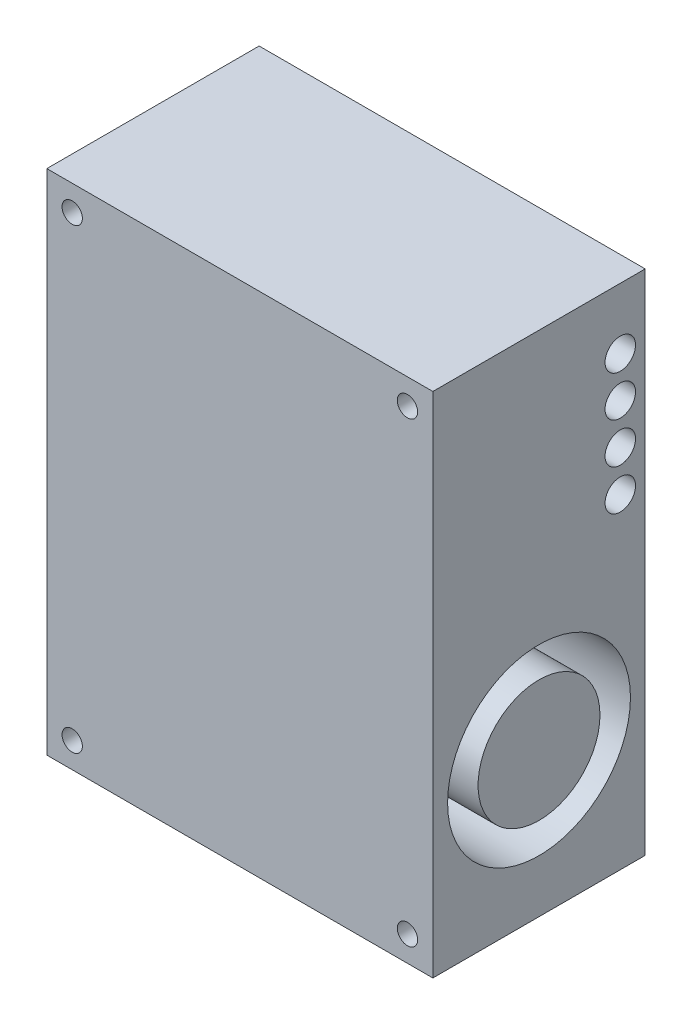
from build123d import *

# Parameters (mm, degrees)
SKETCH1_W           = 38
SKETCH1_H           = 50
BOSS_EXTRUDE1_DEPTH = 20.9
SKETCH2_W           = 4.9
SKETCH2_H           = 17
CUT_EXTRUDE1_DEPTH  = 10
SKETCH3_R           = 9
SKETCH3_R_2         = 6
SKETCH3_R_3         = 1.5
CUT_EXTRUDE2_DEPTH  = 10
SKETCH7_R           = 1
CUT_EXTRUDE3_DEPTH  = 10


with BuildPart() as part:
    # Sketch1 → Boss-Extrude1 (new body)
    with BuildSketch(Plane.XY):
        Rectangle(SKETCH1_W, SKETCH1_H)
    extrude(amount=BOSS_EXTRUDE1_DEPTH)

    # Sketch2 → Cut-Extrude1 (cut)
    with BuildSketch(Plane.ZY.offset(19)):
        with Locations((9.95, -11)):
            Rectangle(SKETCH2_W, SKETCH2_H)
    extrude(amount=-CUT_EXTRUDE1_DEPTH, mode=Mode.SUBTRACT)

    # Sketch3 → Cut-Extrude2 (cut)
    # profile 1 of 5: a face of its own
    with BuildSketch(Plane(origin=(19, 0, 0), x_dir=(0, 0, -1), z_dir=(1, 0, 0))):
        with Locations((-10.45, -10.8)):
            Circle(SKETCH3_R)
        with Locations((-10.45, -10.8)):
            Circle(SKETCH3_R_2, mode=Mode.SUBTRACT)
    # profile 2 of 5: a face of its own
    with BuildSketch(Plane(origin=(19, 0, 0), x_dir=(0, 0, -1), z_dir=(1, 0, 0))):
        with Locations((-2.45, 19)):
            Circle(SKETCH3_R_3)
    # profile 3 of 5: a face of its own
    with BuildSketch(Plane(origin=(19, 0, 0), x_dir=(0, 0, -1), z_dir=(1, 0, 0))):
        with Locations((-2.45, 15)):
            Circle(SKETCH3_R_3)
    # profile 4 of 5: a face of its own
    with BuildSketch(Plane(origin=(19, 0, 0), x_dir=(0, 0, -1), z_dir=(1, 0, 0))):
        with Locations((-2.45, 11)):
            Circle(SKETCH3_R_3)
    # profile 5 of 5: a face of its own
    with BuildSketch(Plane(origin=(19, 0, 0), x_dir=(0, 0, -1), z_dir=(1, 0, 0))):
        with Locations((-2.45, 7)):
            Circle(SKETCH3_R_3)
    extrude(amount=-CUT_EXTRUDE2_DEPTH, mode=Mode.SUBTRACT)

    # Sketch7 → Cut-Extrude3 (cut)
    with BuildSketch(Plane.XY.offset(20.9)):
        with Locations((16.5, 22.5)):
            Circle(SKETCH7_R)
        with Locations((16.5, -22.5)):
            Circle(SKETCH7_R)
        with Locations((-16.5, -22.5)):
            Circle(SKETCH7_R)
        with Locations((-16.5, 22.5)):
            Circle(SKETCH7_R)
    extrude(amount=-CUT_EXTRUDE3_DEPTH, mode=Mode.SUBTRACT)


solid = part.part
